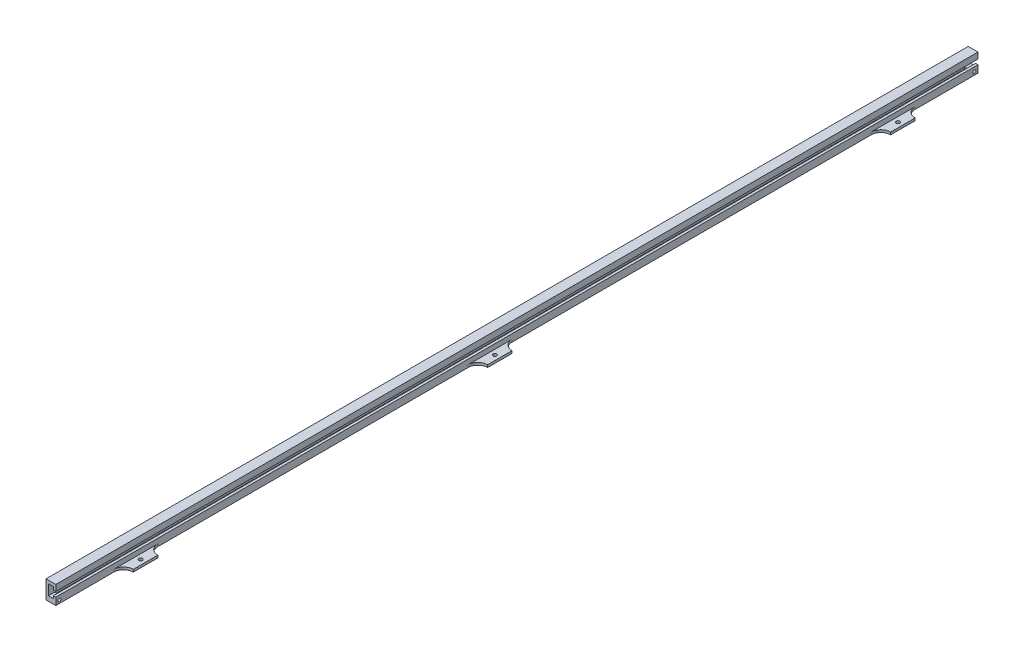
from build123d import *

# Parameters (mm, degrees)
EXTRUDE_1_DEPTH    = 755
SKETCH_4_W         = 8
SKETCH_4_H         = 20
SKETCH_4_R         = 1.5
EXTRUDE_2_DEPTH    = 2
FILLET_1_R         = 8
SKETCH_5_W         = 4
SKETCH_5_H         = 1.5
EXTRUDE_3_DEPTH    = 5
HOLE_WIZARD_M3_2_D = 2.5


with BuildPart() as part:
    # 草图1 → 凸台-拉伸1 (new body)
    with BuildSketch(Plane.XY):
        Polygon((0.29532044, 2.240431683), (8.29532044, 2.240431683), (8.29532044, 8.240431683), (6.29532044, 8.240431683), (6.29532044, 4.740431683), (2.29532044, 4.740431683), (2.29532044, 14.740431683), (6.29532044, 14.740431683), (6.29532044, 12.240431683), (8.29532044, 12.240431683), (8.29532044, 14.740431683), (8.29532044, 17.240431683), (0.29532044, 17.240431683), align=None)
    extrude(amount=EXTRUDE_1_DEPTH)

    # 草图4 → 凸台-拉伸2 (add)
    # profile 1 of 3: a face of its own
    with BuildSketch(Plane(origin=(0, 2.240431683, 0), x_dir=(-1, 0, 0), z_dir=(0, -1, 0))):
        with Locations((-12.29532044, -689.500000045)):
            Rectangle(SKETCH_4_W, SKETCH_4_H)
        with Locations(Location((-12.29532044, -689.500000045, 0), (0, 0, 90))):
            Circle(SKETCH_4_R, mode=Mode.SUBTRACT)
    # profile 2 of 3: a face of its own
    with BuildSketch(Plane(origin=(0, 2.240431683, 0), x_dir=(-1, 0, 0), z_dir=(0, -1, 0))):
        with Locations((-12.29532044, -399.500000045)):
            Rectangle(SKETCH_4_W, SKETCH_4_H)
        with Locations(Location((-12.29532044, -399.500000045, 0), (0, 0, 90))):
            Circle(SKETCH_4_R, mode=Mode.SUBTRACT)
    # profile 3 of 3: a face of its own
    with BuildSketch(Plane(origin=(0, 2.240431683, 0), x_dir=(-1, 0, 0), z_dir=(0, -1, 0))):
        with Locations((-12.29532044, -69.500000045)):
            Rectangle(SKETCH_4_W, SKETCH_4_H)
        with Locations(Location((-12.29532044, -69.500000045, 0), (0, 0, 90))):
            Circle(SKETCH_4_R, mode=Mode.SUBTRACT)
    extrude(amount=-EXTRUDE_2_DEPTH)

    # 圆角1
    fillet_1_edges = [part.edges().sort_by_distance(p)[0] for p in [
        (8.29532044, 3.240431683, 79.500000045),
        (8.29532044, 3.240431683, 59.500000045),
        (8.29532044, 3.240431683, 389.500000045),
        (8.29532044, 3.240431683, 409.500000045),
        (8.29532044, 3.240431683, 679.500000045),
        (8.29532044, 3.240431683, 699.500000045),
    ]]
    fillet(fillet_1_edges, radius=FILLET_1_R - 0.0001)  # a hair under: the kernel refuses the full size

    # 草图5 → 凸台-拉伸3 (add)
    with BuildSketch(Plane.XY.offset(755)):
        with Locations((4.29532044, 5.490431683)):
            Rectangle(SKETCH_5_W, SKETCH_5_H)
    extrude_3 = extrude(amount=-EXTRUDE_3_DEPTH)

    # M3 螺纹孔2 (through all)
    with Locations(Plane(origin=(8.29532044, 0, 0), x_dir=(0, 0, -1), z_dir=(1, 0, 0))):
        with Locations((-752, 4.740431683)):
            hole_wizard_m3_2 = Hole(HOLE_WIZARD_M3_2_D / 2)

    # 镜向1: 凸台-拉伸3, M3 螺纹孔2 across plane
    add(extrude_3.mirror(Plane(origin=(0, 0, 377.5), x_dir=(1, 0, 0), z_dir=(0, 0, -1))))
    add(hole_wizard_m3_2.mirror(Plane(origin=(0, 0, 377.5), x_dir=(1, 0, 0), z_dir=(0, 0, -1))), mode=Mode.SUBTRACT)


solid = part.part
